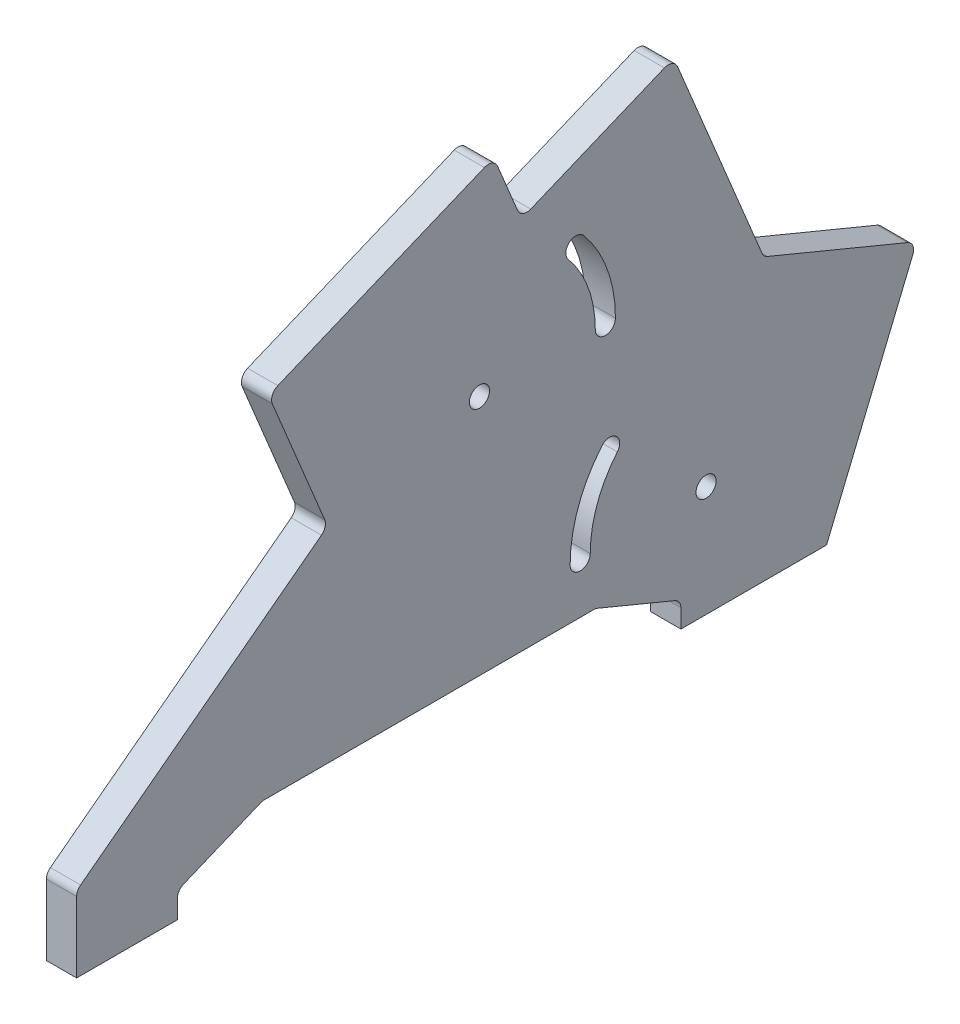
from build123d import *

# Parameters (mm, degrees)
SKETCH1_R                   = 2
BOSS_EXTRUDE1_DEPTH         = 6
FILLET1_R                   = 2
TAP_DRILL_FOR_M3_TAP1_D     = 2.5
TAP_DRILL_FOR_M3_TAP1_DEPTH = 10
TAP_DRILL_FOR_M3_TAP1_TIP   = 0.751075774


with BuildPart() as part:
    # Sketch1 → Boss-Extrude1 (new body)
    with BuildSketch(Plane(origin=(0, 0, 0), x_dir=(0, 0, -1), z_dir=(1, 0, 0))):
        Polygon((0, 0), (0, 15), (49.854455432, 52.772847367), (38.110170638, 81.126058999), (82.834388097, 99.651436437), (88.330517158, 86.382607119), (118.575687602, 98.910566914), (136.428533447, 55.809984346), (166.824723678, 43.219470108), (148.922633001, 0), (120, 0), (120, 5), (103.100505063, 12), (36.899494937, 12), (20, 5), (20, 0), align=None)
        with Locations((80, 60)):
            Circle(SKETCH1_R, mode=Mode.SUBTRACT)
        with Locations((125, 22)):
            Circle(SKETCH1_R, mode=Mode.SUBTRACT)
        with BuildLine():
            ThreePointArc((107, 60), (105.371700761, 69.23454387), (100.683199964, 77.355265462))
            ThreePointArc((100.683199964, 77.355265462), (97.865535859, 77.601779128), (97.619022192, 74.784115023))
            ThreePointArc((97.619022192, 74.784115023), (101.612930278, 67.866463296), (103, 60))
            ThreePointArc((103, 60), (105, 58), (107, 60))
        make_face(mode=Mode.SUBTRACT)
        with BuildLine():
            ThreePointArc((104.316800036, 39.355265462), (99.628299239, 31.23454387), (98, 22))
            ThreePointArc((98, 22), (100, 20), (102, 22))
            ThreePointArc((102, 22), (103.387069722, 29.866463296), (107.380977808, 36.784115023))
            ThreePointArc((107.380977808, 36.784115023), (107.134464141, 39.601779128), (104.316800036, 39.355265462))
        make_face(mode=Mode.SUBTRACT)
    extrude(amount=BOSS_EXTRUDE1_DEPTH)

    # Fillet1
    fillet1_edges = [part.edges().sort_by_distance(p)[0] for p in [
        (3, 12, -36.899494937),
        (3, 5, -20),
        (3, 12, -103.100505063),
        (3, 43.219470108, -166.824723678),
        (3, 55.809984346, -136.428533447),
        (3, 98.910566914, -118.575687602),
        (3, 86.382607119, -88.330517158),
        (3, 99.651436437, -82.834388097),
        (3, 81.126058999, -38.110170638),
        (3, 52.772847367, -49.854455432),
        (3, 15, 0),
        (3, 5, -120),
    ]]
    fillet(fillet1_edges, radius=FILLET1_R)

    # Tap Drill for M3 Tap1
    with Locations(Plane(origin=(0, 0, 0), x_dir=(-1, 0, 0), z_dir=(0, -1, 0))):
        with Locations((-3, 10), (-3, 130)):
            Hole(TAP_DRILL_FOR_M3_TAP1_D / 2, depth=TAP_DRILL_FOR_M3_TAP1_DEPTH)
            with Locations((0, 0, -(TAP_DRILL_FOR_M3_TAP1_DEPTH + TAP_DRILL_FOR_M3_TAP1_TIP / 2))):  # 118° drill point
                Cone(0, TAP_DRILL_FOR_M3_TAP1_D / 2, TAP_DRILL_FOR_M3_TAP1_TIP, mode=Mode.SUBTRACT)


solid = part.part
